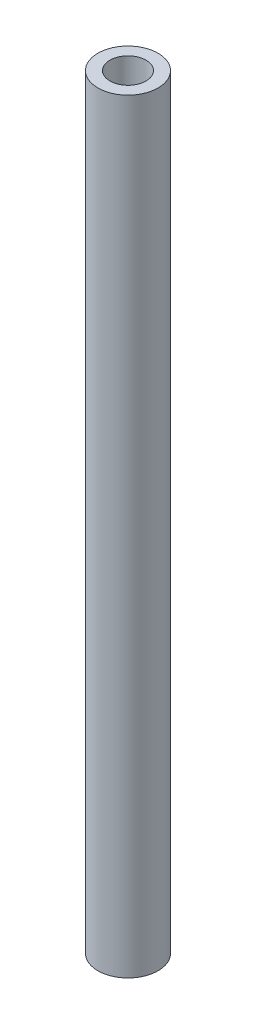
from build123d import *

# Parameters (mm, degrees)
SKETCH1_R                       = 3.5
BOSS_EXTRUDE1_DEPTH             = 88.9
TAP_DRILL_FOR_M5X0_8_TAP1_D     = 4.2
TAP_DRILL_FOR_M5X0_8_TAP1_DEPTH = 25.0000008
TAP_DRILL_FOR_M5X0_8_TAP1_TIP   = 1.2618073
TAP_DRILL_FOR_M5X0_8_TAP2_D     = 4.2
TAP_DRILL_FOR_M5X0_8_TAP2_DEPTH = 24.892
TAP_DRILL_FOR_M5X0_8_TAP2_TIP   = 1.2618073


with BuildPart() as part:
    # Sketch1 → Boss-Extrude1 (new body)
    with BuildSketch(Plane(origin=(0, 0, 0), x_dir=(1, 0, 0), z_dir=(0, 1, 0))):
        Circle(SKETCH1_R)
    extrude(amount=BOSS_EXTRUDE1_DEPTH)

    # Tap Drill for M5x0.8 Tap1
    with Locations(Plane(origin=(0, 88.9, 0), x_dir=(1, 0, 0), z_dir=(0, 1, 0))):
        with Locations((0, 0)):
            Hole(TAP_DRILL_FOR_M5X0_8_TAP1_D / 2, depth=TAP_DRILL_FOR_M5X0_8_TAP1_DEPTH)
            with Locations((0, 0, -(TAP_DRILL_FOR_M5X0_8_TAP1_DEPTH + TAP_DRILL_FOR_M5X0_8_TAP1_TIP / 2))):  # 118° drill point
                Cone(0, TAP_DRILL_FOR_M5X0_8_TAP1_D / 2, TAP_DRILL_FOR_M5X0_8_TAP1_TIP, mode=Mode.SUBTRACT)

    # Tap Drill for M5x0.8 Tap2
    with Locations(Plane(origin=(0, 0, 0), x_dir=(-1, 0, 0), z_dir=(0, -1, 0))):
        with Locations((0, 0)):
            Hole(TAP_DRILL_FOR_M5X0_8_TAP2_D / 2, depth=TAP_DRILL_FOR_M5X0_8_TAP2_DEPTH)
            with Locations((0, 0, -(TAP_DRILL_FOR_M5X0_8_TAP2_DEPTH + TAP_DRILL_FOR_M5X0_8_TAP2_TIP / 2))):  # 118° drill point
                Cone(0, TAP_DRILL_FOR_M5X0_8_TAP2_D / 2, TAP_DRILL_FOR_M5X0_8_TAP2_TIP, mode=Mode.SUBTRACT)


solid = part.part
